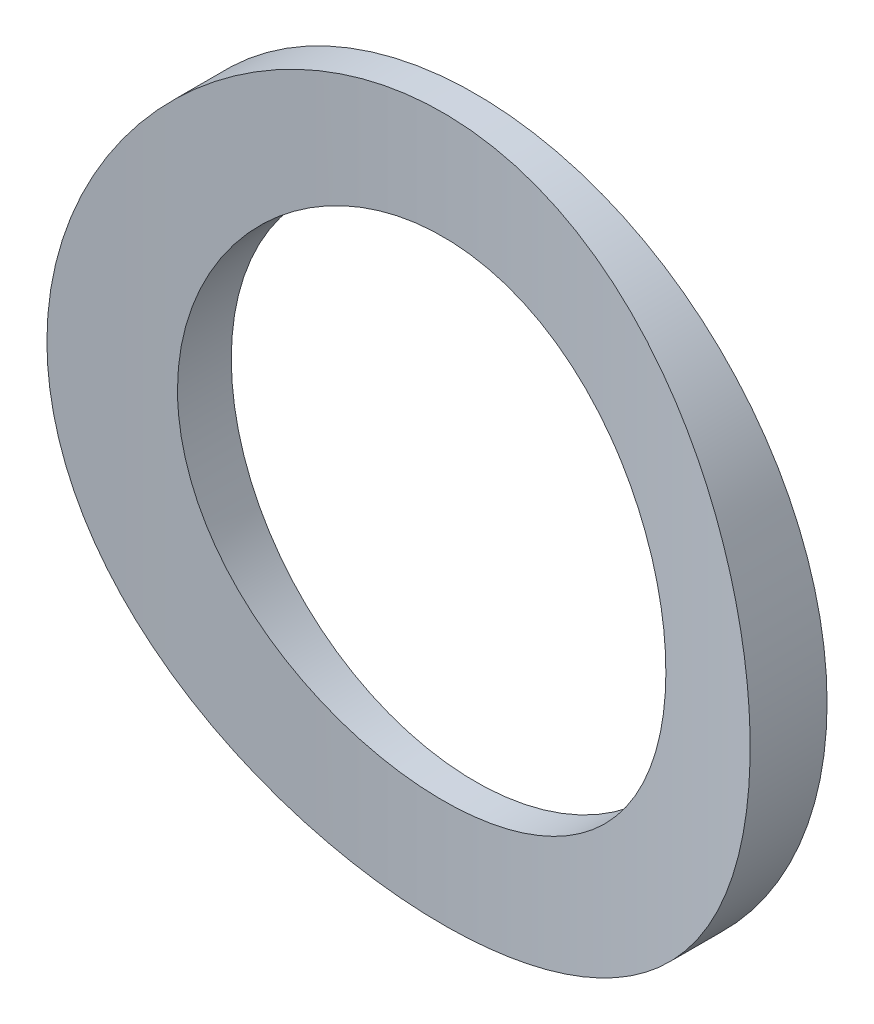
from build123d import *

# Parameters (mm, degrees)
SKETCH1_R               = 10.8
SKETCH1_R_2             = 7.5
BOSS_EXTRUDE1_DEPTH     = 30
CUT_EXTRUDE1_DEPTH      = 34.664224334
CUT_EXTRUDE1_DEPTH_BACK = 34.664224334
SKETCH2_R               = 43.5


with BuildPart() as part:
    # Sketch1 → Boss-Extrude1 (new body)
    with BuildSketch(Plane.XY):
        Circle(SKETCH1_R)
        Circle(SKETCH1_R_2, mode=Mode.SUBTRACT)
    extrude(amount=BOSS_EXTRUDE1_DEPTH)

    # Sketch2 → Cut-Extrude1 (cut, two sides: drawn at the far end of the back side and taken through both)
    with BuildSketch(Plane(origin=(0, 0, 0), x_dir=(1, 0, 0), z_dir=(0, 1, 0)).offset(-CUT_EXTRUDE1_DEPTH_BACK)):
        with Locations((0, -44.5)):
            Circle(SKETCH2_R)
    extrude(amount=CUT_EXTRUDE1_DEPTH + CUT_EXTRUDE1_DEPTH_BACK, mode=Mode.SUBTRACT)


solid = part.part
